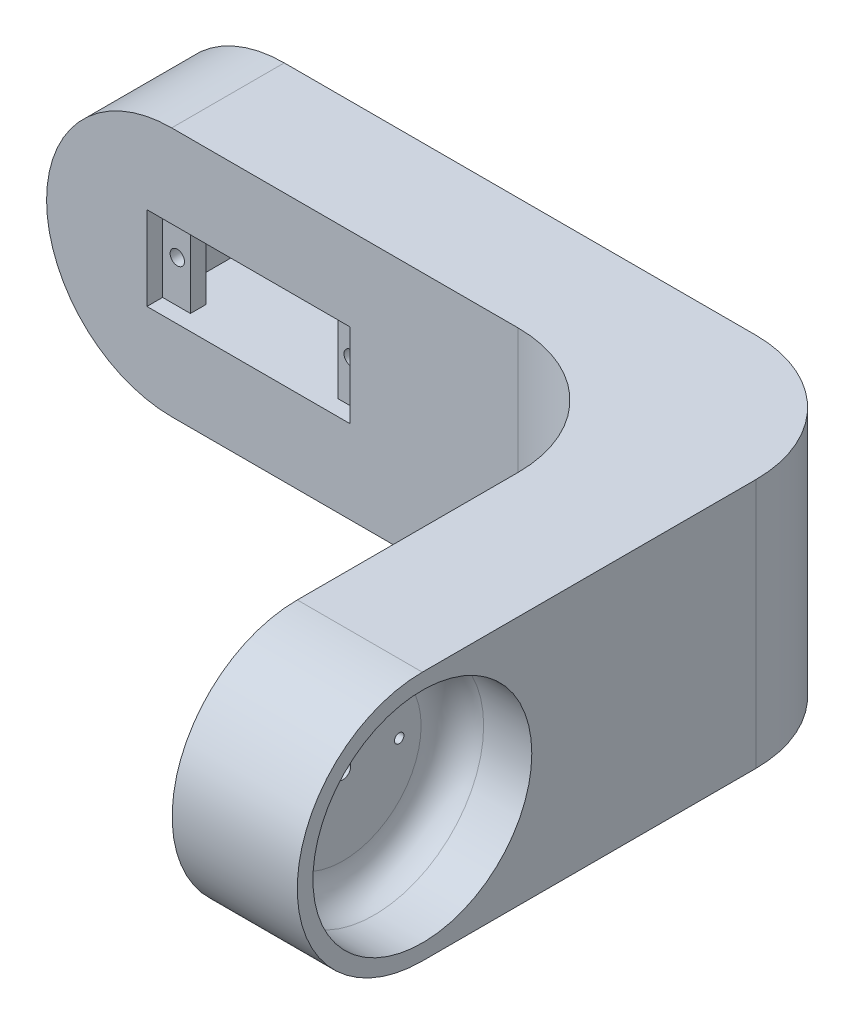
from build123d import *

# Parameters (mm, degrees)
BOSS_EXTRUDE1_DEPTH = 20
SKETCH2_R           = 17.5
CUT_EXTRUDE1_DEPTH  = 12.7
CUT_EXTRUDE2_START  = -4.8
SKETCH3_R           = 17.5
CUT_EXTRUDE2_DEPTH  = 4.8
SKETCH4_R           = 1.25
SKETCH4_R_2         = 0.75
CUT_EXTRUDE3_DEPTH  = 4.8
SKETCH5_W           = 18
SKETCH5_H           = 40
BOSS_EXTRUDE2_DEPTH = 95.4
FILLET1_R           = 20
SKETCH7_W           = 32.5
SKETCH7_H           = 13.4
CUT_EXTRUDE4_DEPTH  = 2.5
FILLET2_R           = 5
FILLET3_R           = 20
SKETCH8_W           = 32.5
SKETCH8_H           = 13.4
CUT_EXTRUDE5_DEPTH  = 13
SKETCH9_R           = 1.15
SKETCH9_W           = 23.6
SKETCH9_H           = 13.4
CUT_EXTRUDE6_DEPTH  = 13


# Some blends are built 0.0001 mm under size
with BuildPart() as part:
    # Sketch1 → Boss-Extrude1 (new body)
    with BuildSketch(Plane(origin=(0, 0, 0), x_dir=(0, 0, -1), z_dir=(1, 0, 0))):
        with BuildLine():
            Line((73.32, 20), (0, 20))
            ThreePointArc((0, 20), (14.142135624, 14.142135624), (20, 0))
            ThreePointArc((20, 0), (14.142135624, -14.142135624), (0, -20))
            Line((0, -20), (73.32, -20))
            Line((73.32, -20), (73.32, 20))
        make_face()
        with BuildLine():
            ThreePointArc((20, 0), (14.142135624, 14.142135624), (0, 20))
            Line((0, 20), (0, -20))
            ThreePointArc((0, -20), (14.142135624, -14.142135624), (20, 0))
        make_face()
        with BuildLine():
            Line((0, -20), (0, 20))
            ThreePointArc((0, 20), (-20, 0), (0, -20))
        make_face()
    extrude(amount=BOSS_EXTRUDE1_DEPTH)

    # Sketch2 → Cut-Extrude1 (cut)
    with BuildSketch(Plane(origin=(20, 0, 0), x_dir=(0, 0, -1), z_dir=(1, 0, 0))):
        Circle(SKETCH2_R)
    extrude(amount=-CUT_EXTRUDE1_DEPTH, mode=Mode.SUBTRACT)

    # Sketch3 → Cut-Extrude2 (cut)
    with BuildSketch(Plane.ZY.offset(CUT_EXTRUDE2_START)):
        with Locations(Location((0, 0, 0), (0, 0, 180))):
            Circle(SKETCH3_R)
    extrude(amount=CUT_EXTRUDE2_DEPTH, mode=Mode.SUBTRACT)

    # Sketch4 → Cut-Extrude3 (cut)
    with BuildSketch(Plane.ZY.offset(-4.8)):
        Circle(SKETCH4_R)
        with Locations((-9, 0)):
            Circle(SKETCH4_R_2)
        with Locations((9, 0)):
            Circle(SKETCH4_R_2)
    extrude(amount=-CUT_EXTRUDE3_DEPTH, mode=Mode.SUBTRACT)

    # Sketch5 → Boss-Extrude2 (add)
    with BuildSketch(Plane.ZY):
        with Locations((-64.32, 0)):
            Rectangle(SKETCH5_W, SKETCH5_H)
    extrude(amount=BOSS_EXTRUDE2_DEPTH)

    # Fillet1
    fillet1_edges = [part.edges().sort_by_distance(p)[0] for p in [
        (-95.4, -20, -64.32),
        (-95.4, 20, -64.32),
    ]]
    fillet(fillet1_edges, radius=FILLET1_R - 0.0001)  # a hair under: the kernel refuses the full size

    # Sketch7 → Cut-Extrude4 (cut)
    with BuildSketch(Plane.XY.offset(-55.32)):
        with Locations((-63.1, 0)):
            Rectangle(SKETCH7_W, SKETCH7_H)
    extrude(amount=-CUT_EXTRUDE4_DEPTH, mode=Mode.SUBTRACT)

    # Fillet2
    # the kernel refuses this fillet: 5 mm, written as the material it adds along each edge
    with BuildSketch(Plane(origin=(7.3, 0, 0), x_dir=(0, 0, -1), z_dir=(0, -1, 0))) as fillet2_piece_1:
        with BuildLine():
            CenterArc((17.5 - FILLET2_R, FILLET2_R), FILLET2_R, 270, 90)
            Line((17.5 - FILLET2_R, 0), (17.5 - FILLET2_R, -FILLET2_R * 0.02))
            Line((17.5 - FILLET2_R, -FILLET2_R * 0.02), (17.5 + FILLET2_R * 0.02, -FILLET2_R * 0.02))
            Line((17.5 + FILLET2_R * 0.02, -FILLET2_R * 0.02), (17.5 + FILLET2_R * 0.02, FILLET2_R))
            Line((17.5 + FILLET2_R * 0.02, FILLET2_R), (17.5, FILLET2_R))
        make_face()
    revolve(axis=Axis((7.3, 0, 0), (1, 0, 0)))
    with BuildSketch(Plane(origin=(4.8, 0, 0), x_dir=(0, 0, -1), z_dir=(0, 1, 0))) as fillet2_piece_2:
        with BuildLine():
            CenterArc((12.504001601, 5), FILLET2_R, 270, 87.707557224)
            Line((12.504001601, 0), (12.504001601, -0.1))
            Line((12.504001601, -0.1), (17.5, -0.1))
            Line((17.5, -0.1), (17.6, 0))
            ThreePointArc((17.6, 0), (17.6, 2.4), (17.599919968, 4.796))
            Line((17.599919968, 4.796), (17.5, 4.8))
        make_face()
    revolve(axis=Axis((4.8, 0, 0), (-1, 0, 0)))

    # Fillet3
    fillet3_edges = [part.edges().sort_by_distance(p)[0] for p in [
        (20, 0, -73.32),
        (0, 0, -55.32),
    ]]
    fillet(fillet3_edges, radius=FILLET3_R)

    # Sketch8 → Cut-Extrude5 (cut)
    with BuildSketch(Plane(origin=(0, 0, -73.32), x_dir=(-1, 0, 0), z_dir=(0, 0, -1))):
        with Locations((63.1, 0)):
            Rectangle(SKETCH8_W, SKETCH8_H)
    extrude(amount=-CUT_EXTRUDE5_DEPTH, mode=Mode.SUBTRACT)

    # Sketch9 → Cut-Extrude6 (cut)
    with BuildSketch(Plane.XY.offset(-57.82)):
        with Locations((-77, 0)):
            Circle(SKETCH9_R)
        with Locations((-49.2, 0)):
            Circle(SKETCH9_R)
        with Locations((-63.1, 0)):
            Rectangle(SKETCH9_W, SKETCH9_H)
    extrude(amount=-CUT_EXTRUDE6_DEPTH, mode=Mode.SUBTRACT)


solid = part.part
